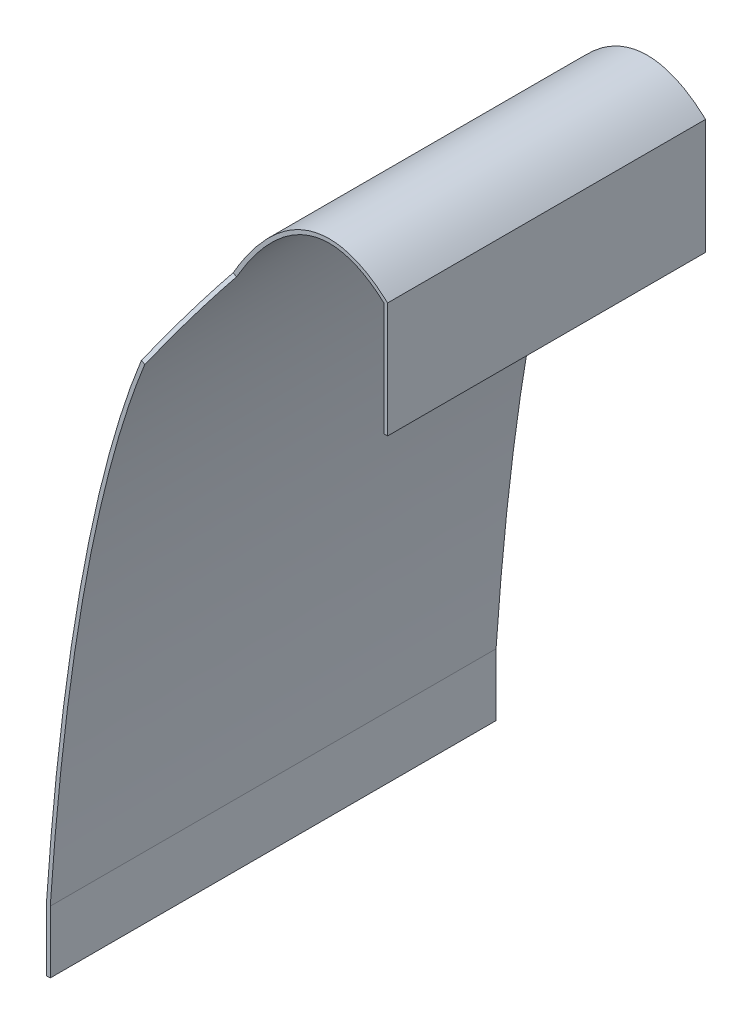
from build123d import *

# Parameters (mm, degrees)
BOSS_EXTRUDE1_DEPTH = 5.77
BOSS_EXTRUDE2_DEPTH = 2.32
BOSS_EXTRUDE3_DEPTH = 2.32
CHAMFER1_SIZE       = 2.32


with BuildPart() as part:
    # Sketch1 → Boss-Extrude1 (new, symmetric)
    with BuildSketch(Plane.XY):
        with BuildLine():
            Line((-1.795, 32), (-1.795, 36.118851551))
            add(Edge.make_bspline(
                [(-1.795, 36.118851551), (-1.916413758, 36.22760972), (-2.177815582, 36.439235172), (-2.681829407, 36.757015714), (-3.316577631, 36.995478802), (-4.069386604, 37.021222011), (-5.069513478, 36.71468324), (-6.308355194, 35.676284837), (-7.718941605, 33.366953376), (-9.000843865, 30.000090311), (-9.924387897, 26.316710636), (-10.554581767, 22.844416107), (-10.9674096, 19.979493878), (-11.257504272, 17.369164983), (-11.453633699, 15.160682005), (-11.54081446, 13.993687059), (-11.58, 13.417622262)],
                knots=[0.001886507, 0.001886507, 0.001886507, 0.001886507, 0.033076241, 0.064265974, 0.126645441, 0.189024907, 0.251404374, 0.376163307, 0.50092224, 0.625681173, 0.750440107, 0.812819573, 0.87519904, 0.937578506, 0.96876824, 0.999957973, 0.999957973, 0.999957973, 0.999957973], degree=3))
            Line((-11.58, 13.417622262), (-11.58, 11.16))
            Line((-11.58, 11.16), (-11.72, 11.16))
            Line((-11.72, 11.16), (-11.72, 13.422377426))
            add(Edge.make_bspline(
                [(-1.655, 36.181024727), (-1.78096177, 36.295212499), (-2.049252699, 36.519701368), (-2.5749842, 36.861164951), (-3.244623419, 37.126312429), (-4.050347598, 37.168032281), (-5.11349256, 36.857636773), (-6.394188079, 35.796729977), (-7.826918654, 33.4687247), (-9.122398974, 30.083952505), (-10.053547866, 26.383421198), (-10.688383501, 22.894879517), (-11.103994797, 20.016382989), (-11.39584536, 17.393436028), (-11.59304272, 15.174115369), (-11.680630204, 14.001303383), (-11.72, 13.422377426)],
                knots=[-0.001861847, -0.001861847, -0.001861847, -0.001861847, 0.029447649, 0.060757144, 0.123376135, 0.185995126, 0.248614117, 0.373852099, 0.499090081, 0.624328063, 0.749566045, 0.812185036, 0.874804027, 0.937423018, 0.968732514, 1.000042009, 1.000042009, 1.000042009, 1.000042009], degree=3))
            Line((-1.655, 36.181024727), (-1.655, 32))
            Line((-1.655, 32), (-1.795, 32))
        make_face()
    extrude(amount=BOSS_EXTRUDE1_DEPTH, both=True)

    # Sketch2 → Boss-Extrude2 (add)
    with BuildSketch(Plane.XY.offset(5.77)):
        with BuildLine():
            Line((-7.261696588, 34.326646798), (-7.140482194, 34.256464712))
            add(Edge.make_bspline(
                [(-11.58, 13.417622262), (-11.54081446, 13.993687059), (-11.453633699, 15.160682005), (-11.257504272, 17.369164983), (-10.9674096, 19.979493878), (-10.554581767, 22.844416107), (-9.924387897, 26.316710636), (-9.000843865, 30.000090311), (-7.972630037, 32.700651242), (-7.329300953, 33.930347992), (-7.140482194, 34.256464712)],
                knots=[0.001886507, 0.001886507, 0.001886507, 0.001886507, 0.033076241, 0.064265974, 0.126645441, 0.189024907, 0.251404374, 0.376163307, 0.50092224, 0.551611802, 0.551611802, 0.551611802, 0.551611802], degree=3))
            Line((-11.58, 13.417622262), (-11.58, 11.16))
            Line((-11.58, 11.16), (-11.72, 11.16))
            Line((-11.72, 11.16), (-11.72, 13.422377426))
            add(Edge.make_bspline(
                [(-7.261696588, 34.326646798), (-7.445742449, 34.008763214), (-8.090261056, 32.78067562), (-9.122398974, 30.083952505), (-10.053547866, 26.383421198), (-10.688383501, 22.894879517), (-11.103994797, 20.016382989), (-11.39584536, 17.393436028), (-11.59304272, 15.174115369), (-11.680630204, 14.001303383), (-11.72, 13.422377426)],
                knots=[0.450226407, 0.450226407, 0.450226407, 0.450226407, 0.499090081, 0.624328063, 0.749566045, 0.812185036, 0.874804027, 0.937423018, 0.968732514, 1.000042009, 1.000042009, 1.000042009, 1.000042009], degree=3))
        make_face()
    extrude(amount=BOSS_EXTRUDE2_DEPTH)

    # Sketch3 → Boss-Extrude3 (add)
    with BuildSketch(Plane(origin=(0, 0, -5.77), x_dir=(-1, 0, 0), z_dir=(0, 0, -1))):
        with BuildLine():
            Line((11.72, 11.16), (11.72, 13.422377426))
            add(Edge.make_bspline(
                [(11.72, 13.422377426), (11.680630204, 14.001303383), (11.59304272, 15.174115369), (11.39584536, 17.393436028), (11.103994797, 20.016382989), (10.688383501, 22.894879517), (10.053547866, 26.383421198), (9.122398974, 30.083952505), (8.090261056, 32.78067562), (7.445742449, 34.008763214), (7.261696588, 34.326646798)],
                knots=[0.450226407, 0.450226407, 0.450226407, 0.450226407, 0.481535903, 0.512845399, 0.57546439, 0.638083381, 0.700702372, 0.825940354, 0.951178336, 1.000042009, 1.000042009, 1.000042009, 1.000042009], degree=3))
            Line((7.261696588, 34.326646798), (7.140482194, 34.256464712))
            add(Edge.make_bspline(
                [(7.140482194, 34.256464712), (7.329300953, 33.930347992), (7.972630037, 32.700651242), (9.000843865, 30.000090311), (9.924387897, 26.316710636), (10.554581767, 22.844416107), (10.9674096, 19.979493878), (11.257504272, 17.369164983), (11.453633699, 15.160682005), (11.54081446, 13.993687059), (11.58, 13.417622262)],
                knots=[0.001886507, 0.001886507, 0.001886507, 0.001886507, 0.052576069, 0.177335002, 0.302093936, 0.364473402, 0.426852869, 0.489232335, 0.520422069, 0.551611802, 0.551611802, 0.551611802, 0.551611802], degree=3))
            Line((11.58, 13.417622262), (11.58, 11.16))
            Line((11.58, 11.16), (11.72, 11.16))
        make_face()
    extrude(amount=BOSS_EXTRUDE3_DEPTH)

    # Chamfer1
    # the kernel refuses this chamfer: 2.32 mm, written as the material it takes off along each edge
    with BuildSketch(Plane(origin=(-12.424994889, 37.316151845, -8.09), x_dir=(0.013777215269711263, 0.023795200566428396, 0.9996219169112969), z_dir=(0.8654097813803823, -0.5010647765420745, 0))) as chamfer1_piece_1_section:
        Polygon((CHAMFER1_SIZE * 0.999621916911, CHAMFER1_SIZE * 0.0274958766106), (-CHAMFER1_SIZE * 0.0274958766106, CHAMFER1_SIZE * 0.999621916911), (0, 0), align=None)
    chamfer1_piece_1 = extrude(amount=12.072674958, mode=Mode.PRIVATE)
    chamfer1_piece_1 = split(chamfer1_piece_1, bisect_by=Plane(origin=(-7.585174401, 33.628186585, -5.77), z_dir=(0, 0, -1)), keep=Keep.TOP, mode=Mode.PRIVATE)
    add(chamfer1_piece_1, mode=Mode.SUBTRACT)
    with BuildSketch(Plane(origin=(-12.424994889, 37.316151845, 8.09), x_dir=(0.013777215269710603, 0.023795200566430884, -0.9996219169112966), z_dir=(0.8654097813804155, -0.5010647765420173, 0))) as chamfer1_piece_2_section:
        Polygon((CHAMFER1_SIZE * 0.999621916911, -CHAMFER1_SIZE * 0.0274958766106), (-CHAMFER1_SIZE * 0.0274958766106, -CHAMFER1_SIZE * 0.999621916911), (0, 0), align=None)
    chamfer1_piece_2 = extrude(amount=12.072674958, mode=Mode.PRIVATE)
    chamfer1_piece_2 = split(chamfer1_piece_2, bisect_by=Plane(origin=(-7.585174401, 33.628186585, 5.77), z_dir=(0, 0, 1)), keep=Keep.TOP, mode=Mode.PRIVATE)
    add(chamfer1_piece_2, mode=Mode.SUBTRACT)


solid = part.part
